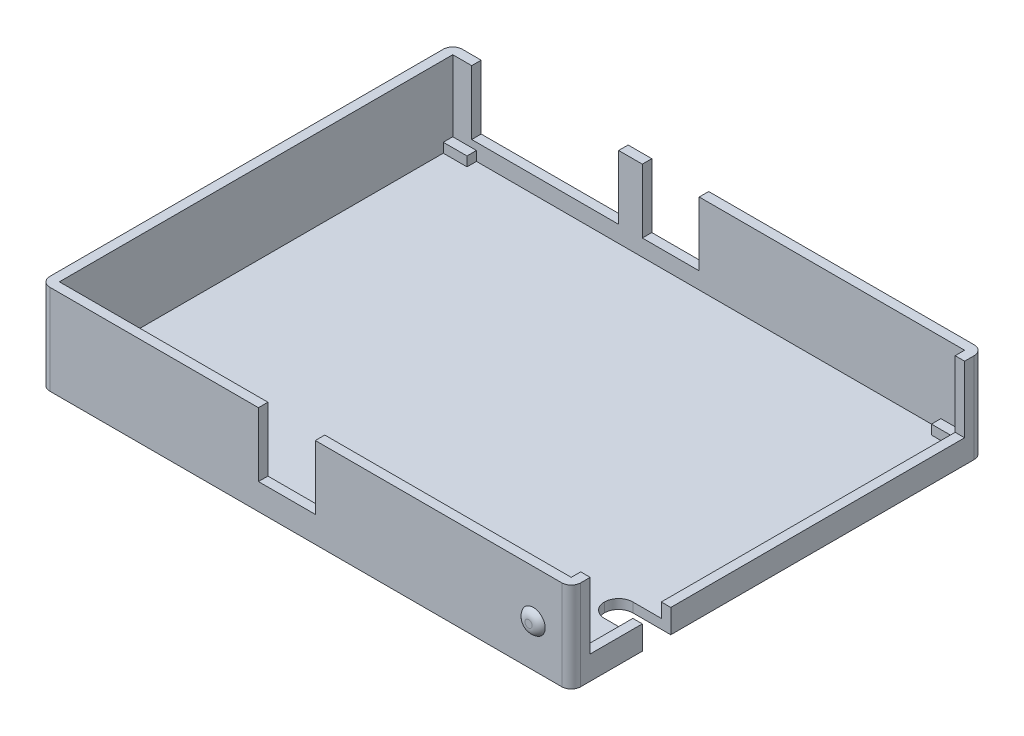
from build123d import *

# Parameters (mm, degrees)
SKETCH1_W           = 112
SKETCH1_H           = 87
BOSS_EXTRUDE1_DEPTH = 19
SKETCH3_W           = 108
SKETCH3_H           = 83
CUT_EXTRUDE1_DEPTH  = 17
SKETCH4_W           = 5
SKETCH4_H           = 2
BOSS_EXTRUDE3_DEPTH = 2
SKETCH5_W           = 5
SKETCH5_H           = 2
BOSS_EXTRUDE4_DEPTH = 2
SKETCH6_W           = 5
SKETCH6_H           = 2
BOSS_EXTRUDE5_DEPTH = 2
SKETCH7_W           = 5
SKETCH7_H           = 2
BOSS_EXTRUDE6_DEPTH = 2
SKETCH8_W           = 12
SKETCH8_H           = 13.5
CUT_EXTRUDE2_DEPTH  = 2
SKETCH9_W           = 31
SKETCH9_H           = 13.5
CUT_EXTRUDE3_DEPTH  = 2
SKETCH10_W          = 12
SKETCH10_H          = 13.5
CUT_EXTRUDE4_DEPTH  = 2
FILLET2_R           = 2
FILLET3_R           = 2
FILLET4_R           = 2
FILLET5_R           = 2
SKETCH11_W          = 0.314102564
SKETCH11_H          = 2.557692308
CUT_EXTRUDE5_DEPTH  = 0.5
SKETCH13_W          = 79
SKETCH13_H          = 14
CUT_EXTRUDE6_DEPTH  = 2
SKETCH14_W          = 6
SKETCH14_H          = 5
CUT_EXTRUDE8_DEPTH  = 11
FILLET6_R           = 3
SKETCH15_R          = 2.5
BOSS_EXTRUDE7_DEPTH = 1
BOSS_EXTRUDE8_START = 1
SKETCH16_R          = 2.5
BOSS_EXTRUDE8_DEPTH = 1
FILLET8_R           = 2
FILLET9_R           = 2


# Some blends are built 0.0001 mm under size
with BuildPart() as part:
    # Sketch1 → Boss-Extrude1 (new body)
    with BuildSketch(Plane(origin=(0, 0, 0), x_dir=(1, 0, 0), z_dir=(0, 1, 0))):
        with Locations((-56, 43.5)):
            Rectangle(SKETCH1_W, SKETCH1_H)
    extrude(amount=BOSS_EXTRUDE1_DEPTH)

    # Sketch3 → Cut-Extrude1 (cut)
    with BuildSketch(Plane(origin=(0, 19, 0), x_dir=(1, 0, 0), z_dir=(0, 1, 0))):
        with Locations((-56, 43.5)):
            Rectangle(SKETCH3_W, SKETCH3_H)
    extrude(amount=-CUT_EXTRUDE1_DEPTH, mode=Mode.SUBTRACT)

    # Sketch4 → Boss-Extrude3 (add)
    with BuildSketch(Plane(origin=(0, 2, 0), x_dir=(1, 0, 0), z_dir=(0, 1, 0))):
        with Locations((-107.5, 84)):
            Rectangle(SKETCH4_W, SKETCH4_H)
    extrude(amount=BOSS_EXTRUDE3_DEPTH)

    # Sketch5 → Boss-Extrude4 (add)
    with BuildSketch(Plane(origin=(0, 2, 0), x_dir=(1, 0, 0), z_dir=(0, 1, 0))):
        with Locations((-4.5, 84)):
            Rectangle(SKETCH5_W, SKETCH5_H)
    extrude(amount=BOSS_EXTRUDE4_DEPTH)

    # Sketch6 → Boss-Extrude5 (add)
    with BuildSketch(Plane(origin=(0, 2, 0), x_dir=(1, 0, 0), z_dir=(0, 1, 0))):
        with Locations((-107.5, 3)):
            Rectangle(SKETCH6_W, SKETCH6_H)
    extrude(amount=BOSS_EXTRUDE5_DEPTH)

    # Sketch7 → Boss-Extrude6 (add)
    with BuildSketch(Plane(origin=(0, 2, 0), x_dir=(1, 0, 0), z_dir=(0, 1, 0))):
        with Locations((-4.5, 3)):
            Rectangle(SKETCH7_W, SKETCH7_H)
    extrude(amount=BOSS_EXTRUDE6_DEPTH)

    # Sketch8 → Cut-Extrude2 (cut)
    with BuildSketch(Plane.XY):
        with Locations((-60, 12.25)):
            Rectangle(SKETCH8_W, SKETCH8_H)
    extrude(amount=-CUT_EXTRUDE2_DEPTH, mode=Mode.SUBTRACT)

    # Sketch9 → Cut-Extrude3 (cut)
    with BuildSketch(Plane(origin=(0, 0, -87), x_dir=(-1, 0, 0), z_dir=(0, 0, -1))):
        with Locations((90.5, 12.25)):
            Rectangle(SKETCH9_W, SKETCH9_H)
    extrude(amount=-CUT_EXTRUDE3_DEPTH, mode=Mode.SUBTRACT)

    # Sketch10 → Cut-Extrude4 (cut)
    with BuildSketch(Plane(origin=(0, 0, -87), x_dir=(-1, 0, 0), z_dir=(0, 0, -1))):
        with Locations((64, 12.25)):
            Rectangle(SKETCH10_W, SKETCH10_H)
    extrude(amount=-CUT_EXTRUDE4_DEPTH, mode=Mode.SUBTRACT)

    # Fillet2
    fillet2_edges = [part.edges().sort_by_distance(p)[0] for p in [
        (-112, 9.5, 0),
    ]]
    fillet(fillet2_edges, radius=FILLET2_R)

    # Fillet3
    fillet3_edges = [part.edges().sort_by_distance(p)[0] for p in [
        (0, 9.5, 0),
    ]]
    fillet(fillet3_edges, radius=FILLET3_R)

    # Fillet4
    fillet4_edges = [part.edges().sort_by_distance(p)[0] for p in [
        (0, 9.5, -87),
    ]]
    fillet(fillet4_edges, radius=FILLET4_R)

    # Fillet5
    fillet5_edges = [part.edges().sort_by_distance(p)[0] for p in [
        (-112, 9.5, -87),
    ]]
    fillet(fillet5_edges, radius=FILLET5_R)

    # Sketch11 → Cut-Extrude5 (cut)
    # profile 1 of 9: a face of its own
    with BuildSketch(Plane(origin=(0, 2, 0), x_dir=(1, 0, 0), z_dir=(0, 1, 0))):
        Polygon((-36.173713221, 7.144580339), (-35.711673958, 10.644580339), (-35.666802163, 10.644580339), (-34.221790144, 7.772785467), (-32.780283734, 10.644580339), (-32.734710817, 10.644580339), (-32.269867067, 7.144580339), (-32.585371875, 7.144580339), (-32.920508093, 9.663009826), (-34.183929567, 7.144580339), (-34.254742868, 7.144580339), (-35.523072195, 9.6686188), (-35.857507292, 7.144580339), align=None)
    # profile 2 of 9: a face of its own
    with BuildSketch(Plane(origin=(0, 2, 0), x_dir=(1, 0, 0), z_dir=(0, 1, 0))):
        with BuildLine():
            add(Edge.make_bspline(
                [(-31.530884695, 10.779195723), (-31.51139338, 10.778291571), (-31.47322564, 10.776521067), (-31.418032372, 10.76135959), (-31.36777536, 10.735659904), (-31.323197627, 10.701180224), (-31.28494574, 10.66063078), (-31.25816503, 10.613369812), (-31.240952634, 10.562311173), (-31.238874079, 10.526696084), (-31.237815785, 10.508562711)],
                knots=[0, 0, 0, 0, 1.055194115, 2.066272739, 3.074728998, 4.095836921, 5.109056067, 6.073838105, 7.019297344, 8, 8, 8, 8], degree=3))
            add(Edge.make_bspline(
                [(-31.237815785, 10.508562711), (-31.238897945, 10.490900057), (-31.241037247, 10.455983082), (-31.258151735, 10.40580961), (-31.285173973, 10.359205327), (-31.323173099, 10.318734617), (-31.36778186, 10.284273997), (-31.418030645, 10.258569258), (-31.473226094, 10.24340912), (-31.511393533, 10.241638432), (-31.530884695, 10.240734185)],
                knots=[0, 0, 0, 0, 0.96129708, 1.900370562, 2.859976407, 3.87933698, 4.906634145, 5.921202961, 6.938410037, 8, 8, 8, 8], degree=3))
            add(Edge.make_bspline(
                [(-31.530884695, 10.240734185), (-31.550152971, 10.241603905), (-31.587656151, 10.243296702), (-31.642022993, 10.25886672), (-31.691851482, 10.284282793), (-31.736516155, 10.318508978), (-31.773746348, 10.359453875), (-31.800844674, 10.405781169), (-31.817919636, 10.455990324), (-31.820064264, 10.49090249), (-31.821149118, 10.508562711)],
                knots=[0, 0, 0, 0, 1.054934014, 2.053291228, 3.073705704, 4.106921865, 5.123545215, 6.088680038, 7.033164197, 8, 8, 8, 8], degree=3))
            add(Edge.make_bspline(
                [(-31.821149118, 10.508562711), (-31.820088032, 10.52669356), (-31.818003991, 10.562303693), (-31.800831875, 10.613398726), (-31.773972067, 10.660380228), (-31.736491503, 10.701405727), (-31.691858043, 10.735651162), (-31.642021298, 10.761062143), (-31.587656599, 10.776633483), (-31.550153123, 10.778326097), (-31.530884695, 10.779195723)],
                knots=[0, 0, 0, 0, 0.98631895, 1.937192651, 2.907499808, 3.917963147, 4.944918757, 5.95915025, 6.951458133, 8, 8, 8, 8], degree=3))
        make_face()
    # profile 3 of 9: a face of its own
    with BuildSketch(Plane(origin=(0, 2, 0), x_dir=(1, 0, 0), z_dir=(0, 1, 0))):
        with Locations((-31.529482452, 8.423426493)):
            Rectangle(SKETCH11_W, SKETCH11_H)
    # profile 4 of 9: a face of its own
    with BuildSketch(Plane(origin=(0, 2, 0), x_dir=(1, 0, 0), z_dir=(0, 1, 0))):
        with BuildLine():
            Line((-28.096790144, 9.147685307), (-28.359710817, 8.984323929))
            add(Edge.make_bspline(
                [(-28.359710817, 8.984323929), (-28.388540683, 9.020152322), (-28.445287378, 9.090674433), (-28.543826614, 9.181684366), (-28.648838028, 9.259851408), (-28.762116076, 9.323555159), (-28.883501876, 9.372776609), (-29.012516727, 9.407606815), (-29.149142232, 9.429311057), (-29.242807431, 9.431777894), (-29.290800561, 9.433041877)],
                knots=[0, 0, 0, 0, 1.026593902, 2.0206758, 2.988051866, 3.946915611, 4.916868779, 5.907761954, 6.927957743, 8, 8, 8, 8], degree=3))
            add(Edge.make_bspline(
                [(-29.290800561, 9.433041877), (-29.329159518, 9.431985035), (-29.40470644, 9.429903613), (-29.515612594, 9.41689312), (-29.621254947, 9.393251111), (-29.722295656, 9.362100155), (-29.818016074, 9.320349865), (-29.908666993, 9.269540109), (-29.995052483, 9.210490068), (-30.074669224, 9.142079523), (-30.147498231, 9.067680855), (-30.210597145, 8.98792716), (-30.265534078, 8.905207269), (-30.308640035, 8.817455527), (-30.343915205, 8.726679473), (-30.367121925, 8.631165618), (-30.382586621, 8.53213761), (-30.384355949, 8.46461927), (-30.385251683, 8.430437711)],
                knots=[0, 0, 0, 0, 1.112346261, 2.190735716, 3.231507886, 4.247384806, 5.251966152, 6.253067467, 7.256802811, 8.280671706, 9.291813951, 10.270744147, 11.225547591, 12.165006084, 13.100104208, 14.043489273, 15.009504848, 16, 16, 16, 16], degree=3))
            add(Edge.make_bspline(
                [(-30.385251683, 8.430437711), (-30.38347243, 8.3856685), (-30.3799379, 8.296733304), (-30.35223644, 8.165455202), (-30.306892033, 8.038531512), (-30.244834182, 7.916863375), (-30.166357048, 7.804269219), (-30.074184484, 7.703285765), (-29.968265401, 7.615869737), (-29.84953307, 7.543397212), (-29.720775327, 7.485135844), (-29.583385222, 7.443628511), (-29.438485442, 7.418576139), (-29.339278695, 7.415420195), (-29.288697195, 7.413811108)],
                knots=[0, 0, 0, 0, 0.966302908, 1.919585723, 2.883856336, 3.870342332, 4.860282998, 5.839159637, 6.814385684, 7.815993281, 8.834850808, 9.858348828, 10.908058873, 12, 12, 12, 12], degree=3))
            add(Edge.make_bspline(
                [(-29.288697195, 7.413811108), (-29.242342011, 7.415110605), (-29.151241773, 7.417664462), (-29.018074488, 7.439193425), (-28.891294577, 7.474437059), (-28.770906546, 7.523584709), (-28.65713038, 7.587112225), (-28.550701205, 7.665471396), (-28.449501267, 7.756407996), (-28.39000429, 7.826725967), (-28.359710817, 7.862529057)],
                knots=[0, 0, 0, 0, 1.039848629, 2.043578496, 3.018386758, 3.987534228, 4.954977003, 5.934852016, 6.948509513, 8, 8, 8, 8], degree=3))
            Line((-28.359710817, 7.862529057), (-28.096790144, 7.690053095))
            add(Edge.make_bspline(
                [(-28.096790144, 7.690053095), (-28.112377846, 7.667162368), (-28.143501513, 7.621456892), (-28.195529139, 7.557012775), (-28.25164897, 7.496691093), (-28.311642067, 7.440572703), (-28.374725077, 7.387314683), (-28.443052987, 7.339463109), (-28.514422598, 7.294328286), (-28.589671756, 7.253715414), (-28.668022454, 7.217209092), (-28.749364443, 7.185817922), (-28.833344256, 7.158847816), (-28.920060632, 7.137410469), (-29.009684531, 7.120299631), (-29.101984165, 7.108945929), (-29.196927747, 7.100470648), (-29.261099898, 7.099964781), (-29.293605048, 7.099708544)],
                knots=[0, 0, 0, 0, 0.954134338, 1.905101784, 2.851144739, 3.791306361, 4.734911809, 5.6936923, 6.663572882, 7.643865596, 8.638447847, 9.640600242, 10.646758161, 11.676244097, 12.717260333, 13.78922464, 14.880174919, 16, 16, 16, 16], degree=3))
            add(Edge.make_bspline(
                [(-29.293605048, 7.099708544), (-29.343215932, 7.100599824), (-29.440453624, 7.102346739), (-29.582776131, 7.121555214), (-29.718789799, 7.15051283), (-29.848448157, 7.192076564), (-29.971771391, 7.245581339), (-30.088644509, 7.310938254), (-30.198680527, 7.388690044), (-30.30079131, 7.477452813), (-30.394572756, 7.573693454), (-30.475098946, 7.677543372), (-30.544944217, 7.78518442), (-30.60103176, 7.898993946), (-30.645678687, 8.017459319), (-30.676183519, 8.141529559), (-30.695913257, 8.270181813), (-30.698196636, 8.357914695), (-30.699354247, 8.402392839)],
                knots=[0, 0, 0, 0, 1.1129367, 2.181364009, 3.217532258, 4.231199276, 5.232079859, 6.230262199, 7.231623845, 8.250719726, 9.263571943, 10.242672461, 11.195837495, 12.138959767, 13.085126421, 14.0317438, 15.002148558, 16, 16, 16, 16], degree=3))
            add(Edge.make_bspline(
                [(-30.699354247, 8.402392839), (-30.698913231, 8.432571273), (-30.698035977, 8.492601161), (-30.687974049, 8.581696227), (-30.674975576, 8.669604773), (-30.652949839, 8.755212492), (-30.627509207, 8.839817782), (-30.595033675, 8.922400883), (-30.556938281, 9.003345556), (-30.513686333, 9.082443286), (-30.464997588, 9.158392825), (-30.411116355, 9.23014649), (-30.354072019, 9.298566256), (-30.291195907, 9.361290016), (-30.225156253, 9.420826207), (-30.154084677, 9.475584332), (-30.078388825, 9.525725323), (-29.999205503, 9.572176338), (-29.916580791, 9.613535773), (-29.831014121, 9.649169011), (-29.743021092, 9.679621587), (-29.652460948, 9.703730506), (-29.559934775, 9.72394793), (-29.464713437, 9.736665776), (-29.367161214, 9.745652049), (-29.301105192, 9.746642841), (-29.267663542, 9.747144441)],
                knots=[0, 0, 0, 0, 0.990994727, 1.971252077, 2.943264845, 3.907940874, 4.872158414, 5.844625996, 6.82015047, 7.809835459, 8.804511986, 9.781214284, 10.756496977, 11.728388426, 12.696359165, 13.676225489, 14.672885716, 15.677705647, 16.690706858, 17.706033469, 18.721040654, 19.747369689, 20.783475414, 21.830280724, 22.901553713, 24, 24, 24, 24], degree=3))
            add(Edge.make_bspline(
                [(-29.267663542, 9.747144441), (-29.225783433, 9.74622255), (-29.142232554, 9.744383376), (-29.018291847, 9.728904724), (-28.896176653, 9.705568308), (-28.77802955, 9.670995478), (-28.665283035, 9.629131822), (-28.559747585, 9.582119108), (-28.463907481, 9.527524504), (-28.375979892, 9.46780439), (-28.295800375, 9.400443484), (-28.222545882, 9.324636527), (-28.154714233, 9.240778048), (-28.116257522, 9.178972316), (-28.096790144, 9.147685307)],
                knots=[0, 0, 0, 0, 1.095225653, 2.184976855, 3.262915854, 4.344593502, 5.400796181, 6.407717688, 7.363229445, 8.282371371, 9.184954523, 10.097238608, 11.036792983, 12, 12, 12, 12], degree=3))
        make_face()
    # profile 5 of 9: a face of its own
    with BuildSketch(Plane(origin=(0, 2, 0), x_dir=(1, 0, 0), z_dir=(0, 1, 0))):
        with BuildLine():
            Line((-27.558328606, 9.702272647), (-27.244226042, 9.702272647))
            Line((-27.244226042, 9.702272647), (-27.244226042, 9.325770243))
            add(Edge.make_bspline(
                [(-27.244226042, 9.325770243), (-27.221037283, 9.360826071), (-27.176688962, 9.42787007), (-27.102976032, 9.516539371), (-27.027472701, 9.589954418), (-26.949817514, 9.648457937), (-26.869439414, 9.692271055), (-26.788102462, 9.724364091), (-26.704526992, 9.743341406), (-26.648365068, 9.745875065), (-26.620227644, 9.747144441)],
                knots=[0, 0, 0, 0, 1.2804753, 2.448899062, 3.506932113, 4.484331642, 5.4025378, 6.288909075, 7.142734305, 8, 8, 8, 8], degree=3))
            add(Edge.make_bspline(
                [(-26.620227644, 9.747144441), (-26.598401318, 9.745953915), (-26.553492232, 9.743504329), (-26.485509643, 9.726293504), (-26.415466191, 9.698815482), (-26.370323803, 9.672975259), (-26.346790144, 9.659504217)],
                knots=[0, 0, 0, 0, 0.901110191, 1.854092781, 2.881294221, 4, 4, 4, 4], degree=3))
            Line((-26.346790144, 9.659504217), (-26.519266106, 9.387468961))
            add(Edge.make_bspline(
                [(-26.519266106, 9.387468961), (-26.534375127, 9.394209227), (-26.563054941, 9.407003542), (-26.605009508, 9.422145552), (-26.643690844, 9.431061468), (-26.668334403, 9.432412186), (-26.679822997, 9.433041877)],
                knots=[0, 0, 0, 0, 1.180555205, 2.24091978, 3.179933427, 4, 4, 4, 4], degree=3))
            add(Edge.make_bspline(
                [(-26.679822997, 9.433041877), (-26.70502873, 9.43136184), (-26.75644112, 9.427935051), (-26.83192562, 9.400996243), (-26.905172825, 9.357471003), (-26.963344487, 9.309199891), (-27.00838674, 9.262652093), (-27.040526966, 9.222003691), (-27.070009713, 9.176425059), (-27.098179933, 9.126695376), (-27.123846227, 9.07196553), (-27.147800897, 9.012782316), (-27.169459759, 8.949077187), (-27.181810004, 8.904694667), (-27.188136298, 8.881960147)],
                knots=[0, 0, 0, 0, 1.125678352, 2.296057538, 3.5422874, 4.923748041, 5.663163013, 6.437101912, 7.23742474, 8.08941207, 8.991984279, 9.93940061, 10.944477711, 12, 12, 12, 12], degree=3))
            add(Edge.make_bspline(
                [(-27.188136298, 8.881960147), (-27.192868691, 8.861682973), (-27.203350583, 8.816770574), (-27.213542121, 8.74142205), (-27.223611639, 8.652398391), (-27.230708257, 8.549451798), (-27.237286299, 8.432839354), (-27.240996382, 8.302383408), (-27.244099522, 8.157950057), (-27.244182589, 8.056975704), (-27.244226042, 8.004155659)],
                knots=[0, 0, 0, 0, 0.566838948, 1.255505196, 2.06880316, 3.007127437, 4.065329342, 5.249902469, 6.561414163, 8, 8, 8, 8], degree=3))
            Line((-27.244226042, 8.004155659), (-27.244226042, 7.144580339))
            Line((-27.244226042, 7.144580339), (-27.558328606, 7.144580339))
            Line((-27.558328606, 7.144580339), (-27.558328606, 9.702272647))
        make_face()
    # profile 6 of 9: a face of its own
    with BuildSketch(Plane(origin=(0, 2, 0), x_dir=(1, 0, 0), z_dir=(0, 1, 0))):
        with BuildLine():
            add(Edge.make_bspline(
                [(-24.797310977, 9.747144441), (-24.749319705, 9.74612255), (-24.655220547, 9.744118871), (-24.517412661, 9.722703906), (-24.385867525, 9.689956541), (-24.260081333, 9.644684979), (-24.141665038, 9.584003029), (-24.028893793, 9.511593738), (-23.922076785, 9.425811144), (-23.858053755, 9.359453076), (-23.82555617, 9.325770243)],
                knots=[0, 0, 0, 0, 1.054011418, 2.066658804, 3.057071809, 4.030435133, 4.997543892, 5.974964718, 6.972108034, 8, 8, 8, 8], degree=3))
            add(Edge.make_bspline(
                [(-23.82555617, 9.325770243), (-23.797574216, 9.293556257), (-23.742151835, 9.229751715), (-23.671086117, 9.126296102), (-23.609864556, 9.019156001), (-23.560801595, 8.906908674), (-23.522116572, 8.790534003), (-23.494650876, 8.669631992), (-23.478313941, 8.544469645), (-23.476110974, 8.459465807), (-23.474995272, 8.416415275)],
                knots=[0, 0, 0, 0, 1.025258237, 2.030674902, 3.01204498, 3.988269485, 4.97094183, 5.956517959, 6.965070386, 8, 8, 8, 8], degree=3))
            add(Edge.make_bspline(
                [(-23.474995272, 8.416415275), (-23.47597661, 8.373115217), (-23.477915778, 8.287552284), (-23.496259394, 8.161532918), (-23.52479048, 8.039338095), (-23.565622318, 7.921479401), (-23.617980428, 7.807596574), (-23.681871115, 7.698187025), (-23.757742732, 7.593034892), (-23.843746729, 7.493033053), (-23.938798605, 7.400866838), (-24.041914754, 7.320538569), (-24.151068787, 7.251717045), (-24.267712141, 7.196280629), (-24.390779627, 7.152570929), (-24.520536696, 7.121870912), (-24.656781766, 7.103309228), (-24.749808987, 7.100925655), (-24.797310977, 7.099708544)],
                knots=[0, 0, 0, 0, 0.998656419, 1.973391657, 2.932242238, 3.890759089, 4.846373663, 5.82037756, 6.809684879, 7.83454468, 8.860553229, 9.859544525, 10.845671541, 11.83227036, 12.833544569, 13.85385346, 14.904124723, 16, 16, 16, 16], degree=3))
            add(Edge.make_bspline(
                [(-24.797310977, 7.099708544), (-24.845045697, 7.10092974), (-24.938536557, 7.103321515), (-25.075262539, 7.121798797), (-25.205252158, 7.15255678), (-25.328480756, 7.196424273), (-25.445625603, 7.251718816), (-25.5554121, 7.320330506), (-25.658612015, 7.400890661), (-25.753684, 7.493026598), (-25.839682605, 7.593036555), (-25.915555614, 7.698186593), (-25.97944594, 7.807596687), (-26.031804144, 7.921479371), (-26.072635956, 8.039338103), (-26.101167049, 8.161532916), (-26.119510664, 8.287552284), (-26.121449832, 8.373115217), (-26.12243117, 8.416415275)],
                knots=[0, 0, 0, 0, 1.099876186, 2.154163076, 3.173186993, 4.173200201, 5.163417411, 6.152872554, 7.150605724, 8.17532212, 9.198891216, 10.186952605, 11.159729845, 12.11414092, 13.071450619, 14.029093627, 15.002601286, 16, 16, 16, 16], degree=3))
            add(Edge.make_bspline(
                [(-26.12243117, 8.416415275), (-26.121307859, 8.459231821), (-26.119083898, 8.544001223), (-26.102763389, 8.668928284), (-26.075404832, 8.789625673), (-26.036673436, 8.905551149), (-25.987158245, 9.017306585), (-25.926796957, 9.124711416), (-25.855006325, 9.227699216), (-25.799804373, 9.291421296), (-25.771870272, 9.323666877)],
                knots=[0, 0, 0, 0, 1.031353054, 2.041901799, 3.029428768, 4.008703097, 4.981709435, 5.96992636, 6.972712378, 8, 8, 8, 8], degree=3))
            add(Edge.make_bspline(
                [(-25.771870272, 9.323666877), (-25.739421681, 9.357641817), (-25.675605817, 9.424459513), (-25.56825709, 9.509992037), (-25.455763269, 9.583908111), (-25.336038342, 9.643384326), (-25.210355484, 9.690222844), (-25.078136242, 9.722788359), (-24.939860726, 9.744041714), (-24.845301105, 9.746099892), (-24.797310977, 9.747144441)],
                knots=[0, 0, 0, 0, 1.027980169, 2.021703884, 2.998553061, 3.971491411, 4.943284454, 5.930300938, 6.949603206, 8, 8, 8, 8], degree=3))
        make_face()
        with BuildLine():
            add(Edge.make_bspline(
                [(-24.798713221, 9.433041877), (-24.832650832, 9.432077286), (-24.899649961, 9.430173003), (-24.998269546, 9.415689098), (-25.0932097, 9.392741594), (-25.184650544, 9.360137538), (-25.272283716, 9.318038639), (-25.356193119, 9.266330279), (-25.436625559, 9.205697322), (-25.512007622, 9.136234651), (-25.581189934, 9.060355656), (-25.641667911, 8.979507297), (-25.693093017, 8.895000951), (-25.735933176, 8.80674874), (-25.767840364, 8.713856326), (-25.791013387, 8.617375695), (-25.805483627, 8.517110278), (-25.807370006, 8.44894926), (-25.808328606, 8.414311909)],
                knots=[0, 0, 0, 0, 1.021534396, 2.016698045, 2.994645724, 3.958388632, 4.93408049, 5.916473867, 6.921342795, 7.962252576, 8.998418191, 10.008913653, 10.997312074, 11.973003931, 12.956656626, 13.948281152, 14.957379055, 16, 16, 16, 16], degree=3))
            add(Edge.make_bspline(
                [(-25.808328606, 8.414311909), (-25.806721782, 8.369559882), (-25.803532538, 8.280735477), (-25.777597301, 8.149924354), (-25.734211021, 8.024342502), (-25.675623742, 7.904726116), (-25.602217523, 7.794053838), (-25.515730456, 7.695382353), (-25.417090756, 7.610196542), (-25.307474256, 7.539515696), (-25.189119938, 7.483355941), (-25.063863617, 7.443556965), (-24.933222923, 7.417685273), (-24.843942191, 7.415113798), (-24.798713221, 7.413811108)],
                knots=[0, 0, 0, 0, 1.016792936, 2.018143844, 3.017858371, 4.030088057, 5.03801393, 6.028138512, 7.003788237, 7.991172063, 8.984598303, 9.972568034, 10.972917682, 12, 12, 12, 12], degree=3))
            add(Edge.make_bspline(
                [(-24.798713221, 7.413811108), (-24.753486852, 7.415121388), (-24.664211256, 7.417707845), (-24.533752079, 7.443426665), (-24.408838107, 7.483530326), (-24.29060672, 7.539452535), (-24.181040116, 7.61046495), (-24.081690995, 7.694901327), (-23.995942384, 7.794315179), (-23.922608779, 7.904872707), (-23.863062036, 8.02415706), (-23.819878835, 8.149947532), (-23.793881249, 8.280729574), (-23.79070042, 8.369557905), (-23.789097836, 8.414311909)],
                knots=[0, 0, 0, 0, 1.02726834, 2.027799167, 3.010890988, 4.004497153, 4.992059811, 5.971914811, 6.958719428, 7.966827853, 8.981595046, 9.981490638, 10.983022906, 12, 12, 12, 12], degree=3))
            add(Edge.make_bspline(
                [(-23.789097836, 8.414311909), (-23.790056106, 8.448949467), (-23.791941836, 8.517110893), (-23.8064168, 8.617373346), (-23.82957234, 8.713864943), (-23.861543957, 8.806716946), (-23.904197971, 8.895229451), (-23.956614764, 8.979259178), (-24.016845789, 9.060635724), (-24.08686291, 9.135989364), (-24.162166288, 9.205724401), (-24.242631326, 9.26635379), (-24.326416305, 9.317811386), (-24.413794887, 9.360497626), (-24.505247455, 9.392444967), (-24.600054584, 9.415821598), (-24.698253394, 9.430111795), (-24.765012437, 9.432058936), (-24.798713221, 9.433041877)],
                knots=[0, 0, 0, 0, 1.042956736, 2.052379634, 3.044323526, 4.02829302, 5.004299113, 5.996692471, 7.007513377, 8.048758398, 9.090003419, 10.095195979, 11.07790575, 12.047570684, 13.018257071, 13.989683339, 14.985167495, 16, 16, 16, 16], degree=3))
        make_face(mode=Mode.SUBTRACT)
    # profile 7 of 9: a face of its own
    with BuildSketch(Plane(origin=(0, 2, 0), x_dir=(1, 0, 0), z_dir=(0, 1, 0))):
        with BuildLine():
            Line((-22.757046554, 10.644580339), (-22.074153926, 10.644580339))
            add(Edge.make_bspline(
                [(-22.074153926, 10.644580339), (-22.040725448, 10.644404588), (-21.975932738, 10.64406394), (-21.881713296, 10.638780809), (-21.793464485, 10.631577139), (-21.711160713, 10.620147047), (-21.63484001, 10.60635527), (-21.564272373, 10.589653453), (-21.499682201, 10.56962684), (-21.422569464, 10.537780559), (-21.334648804, 10.49045739), (-21.239450411, 10.420528825), (-21.158046172, 10.334996362), (-21.087859854, 10.238513707), (-21.032058735, 10.132377935), (-20.991689437, 10.019118746), (-20.966131562, 9.900197004), (-20.963503128, 9.818553826), (-20.962174759, 9.777292679)],
                knots=[0, 0, 0, 0, 1.001505555, 1.941167018, 2.826882275, 3.653841531, 4.429895133, 5.150066043, 5.825578002, 6.45369114, 7.647487171, 8.808567382, 9.977351308, 11.170798116, 12.373658725, 13.556498008, 14.765093433, 16, 16, 16, 16], degree=3))
            add(Edge.make_bspline(
                [(-20.962174759, 9.777292679), (-20.963267978, 9.738640123), (-20.965416255, 9.662684206), (-20.985959015, 9.551590097), (-21.018119683, 9.445838878), (-21.062824932, 9.345816492), (-21.120926928, 9.253782879), (-21.189785247, 9.168995613), (-21.27286205, 9.095044556), (-21.33510529, 9.053701654), (-21.366722035, 9.032701332)],
                knots=[0, 0, 0, 0, 1.044552857, 2.05264487, 3.044412934, 4.028983338, 5.005914585, 5.980388656, 6.974128949, 8, 8, 8, 8], degree=3))
            add(Edge.make_bspline(
                [(-21.366722035, 9.032701332), (-21.326961608, 9.017436333), (-21.25089006, 8.988230609), (-21.146204048, 8.936595145), (-21.056009203, 8.880433035), (-20.979612057, 8.819101185), (-20.914274402, 8.752992374), (-20.85722146, 8.68113726), (-20.808540086, 8.602598502), (-20.766827163, 8.518194966), (-20.734278406, 8.428788498), (-20.709902502, 8.335217722), (-20.695935053, 8.237818167), (-20.693947412, 8.171532787), (-20.69294399, 8.138069922)],
                knots=[0, 0, 0, 0, 1.27268992, 2.434971085, 3.483601985, 4.442670788, 5.356604649, 6.2567628, 7.179492994, 8.113709626, 9.066344395, 10.018646069, 10.999752585, 12, 12, 12, 12], degree=3))
            add(Edge.make_bspline(
                [(-20.69294399, 8.138069922), (-20.693920836, 8.10390305), (-20.695842808, 8.036678772), (-20.71002278, 7.937923637), (-20.734031887, 7.843548691), (-20.767103033, 7.752943508), (-20.810265348, 7.666283374), (-20.862793312, 7.58347011), (-20.925424876, 7.505335779), (-20.995487745, 7.431012156), (-21.07474989, 7.364184369), (-21.160265645, 7.304668662), (-21.253111965, 7.2557226), (-21.351763959, 7.214606578), (-21.457328275, 7.18319938), (-21.569330883, 7.161226806), (-21.687675184, 7.146421769), (-21.768884936, 7.145204564), (-21.810532131, 7.144580339)],
                knots=[0, 0, 0, 0, 0.978564426, 1.925352924, 2.850884081, 3.763762016, 4.682927383, 5.618979971, 6.567305752, 7.547517671, 8.540179244, 9.531824382, 10.526200242, 11.540722885, 12.589160233, 13.674978461, 14.80764778, 16, 16, 16, 16], degree=3))
            Line((-21.810532131, 7.144580339), (-22.757046554, 7.144580339))
            Line((-22.757046554, 7.144580339), (-22.757046554, 10.644580339))
        make_face()
        with BuildLine():
            Line((-22.44294399, 10.28560598), (-22.44294399, 9.163811108))
            Line((-22.44294399, 9.163811108), (-22.23190633, 9.163811108))
            add(Edge.make_bspline(
                [(-22.23190633, 9.163811108), (-22.201057535, 9.164211031), (-22.141451375, 9.164983764), (-22.055131479, 9.167197281), (-21.975006461, 9.173395324), (-21.901214628, 9.179591586), (-21.833872184, 9.189666174), (-21.773128322, 9.201658297), (-21.718029725, 9.214341202), (-21.65449018, 9.235910689), (-21.582417231, 9.267788364), (-21.505584127, 9.3172602), (-21.437849657, 9.376184553), (-21.38065247, 9.444175515), (-21.333840999, 9.519041701), (-21.301327284, 9.599588581), (-21.27928, 9.683808713), (-21.277288468, 9.741626966), (-21.276277324, 9.770982582)],
                knots=[0, 0, 0, 0, 1.156816544, 2.235205308, 3.236616184, 4.169592532, 5.011045266, 5.787822928, 6.49130361, 7.128639758, 8.301311294, 9.436451833, 10.541879658, 11.654887649, 12.756523258, 13.837046038, 14.901820046, 16, 16, 16, 16], degree=3))
            add(Edge.make_bspline(
                [(-21.276277324, 9.770982582), (-21.276803504, 9.790408354), (-21.277835664, 9.828514126), (-21.286288966, 9.88406348), (-21.300656541, 9.936307233), (-21.319110834, 9.985961343), (-21.344899523, 10.031473193), (-21.375262986, 10.074416389), (-21.411948676, 10.113328507), (-21.453705989, 10.149698006), (-21.501714612, 10.181942534), (-21.555945904, 10.210183297), (-21.617133581, 10.232924073), (-21.684246436, 10.252840226), (-21.758317523, 10.26682852), (-21.838492077, 10.278481907), (-21.925426796, 10.284414649), (-21.985571898, 10.285200012), (-22.016661939, 10.28560598)],
                knots=[0, 0, 0, 0, 0.91205012, 1.789085906, 2.630437955, 3.453916878, 4.269457761, 5.079663411, 5.91843418, 6.774407191, 7.675494373, 8.627863946, 9.638891023, 10.736472738, 11.911756761, 13.175263542, 14.539845004, 16, 16, 16, 16], degree=3))
            Line((-22.016661939, 10.28560598), (-22.44294399, 10.28560598))
        make_face(mode=Mode.SUBTRACT)
        with BuildLine():
            Line((-22.44294399, 8.804836749), (-22.44294399, 7.503554698))
            Line((-22.44294399, 7.503554698), (-21.995628285, 7.503554698))
            add(Edge.make_bspline(
                [(-21.995628285, 7.503554698), (-21.963609359, 7.503938445), (-21.901897101, 7.504678068), (-21.812795871, 7.507092622), (-21.730212767, 7.512584898), (-21.654524631, 7.521230748), (-21.584914178, 7.530609197), (-21.522216475, 7.543220478), (-21.465923282, 7.557669438), (-21.400648974, 7.58000361), (-21.327145466, 7.614700081), (-21.247934609, 7.667014308), (-21.177508391, 7.729337616), (-21.117703132, 7.80146853), (-21.068690144, 7.879899857), (-21.033034688, 7.963045207), (-21.011043832, 8.049530734), (-21.008381662, 8.108497447), (-21.007046554, 8.138069922)],
                knots=[0, 0, 0, 0, 1.160039823, 2.235823828, 3.228722157, 4.157150951, 4.99529583, 5.772374946, 6.472645482, 7.099169577, 8.269452708, 9.405989375, 10.527446681, 11.663510218, 12.788923519, 13.866172445, 14.929861265, 16, 16, 16, 16], degree=3))
            add(Edge.make_bspline(
                [(-21.007046554, 8.138069922), (-21.007322659, 8.156563263), (-21.007870414, 8.193251644), (-21.016131029, 8.247167464), (-21.028144898, 8.299393337), (-21.043676332, 8.350071077), (-21.066295799, 8.398284454), (-21.092702344, 8.444987013), (-21.123663746, 8.490240493), (-21.171907912, 8.547452746), (-21.242079897, 8.613369759), (-21.341786672, 8.677907261), (-21.45515897, 8.729955068), (-21.537386463, 8.752054545), (-21.579863061, 8.763470563)],
                knots=[0, 0, 0, 0, 0.723448775, 1.435228256, 2.130040452, 2.821711965, 3.505591119, 4.210454504, 4.921174351, 5.648778258, 7.137944449, 8.670945889, 10.280296675, 12, 12, 12, 12], degree=3))
            add(Edge.make_bspline(
                [(-21.579863061, 8.763470563), (-21.596892157, 8.766925647), (-21.633814749, 8.774416982), (-21.694022329, 8.782324685), (-21.762758198, 8.789369745), (-21.840181076, 8.794580903), (-21.926388917, 8.799967446), (-22.021565835, 8.802062267), (-22.12532315, 8.804561528), (-22.197315522, 8.804742662), (-22.234710817, 8.804836749)],
                knots=[0, 0, 0, 0, 0.634451884, 1.375622551, 2.216452059, 3.157844607, 4.20941857, 5.370758133, 6.634282058, 8, 8, 8, 8], degree=3))
            Line((-22.234710817, 8.804836749), (-22.44294399, 8.804836749))
        make_face(mode=Mode.SUBTRACT)
    # profile 8 of 9: a face of its own
    with BuildSketch(Plane(origin=(0, 2, 0), x_dir=(1, 0, 0), z_dir=(0, 1, 0))):
        with BuildLine():
            add(Edge.make_bspline(
                [(-18.829362259, 9.747144441), (-18.781370987, 9.74612255), (-18.687271829, 9.744118871), (-18.549463943, 9.722703906), (-18.417918807, 9.689956541), (-18.292132615, 9.644684979), (-18.17371632, 9.584003029), (-18.060945076, 9.511593738), (-17.954128067, 9.425811144), (-17.890105037, 9.359453076), (-17.857607452, 9.325770243)],
                knots=[0, 0, 0, 0, 1.054011418, 2.066658804, 3.057071809, 4.030435133, 4.997543892, 5.974964718, 6.972108034, 8, 8, 8, 8], degree=3))
            add(Edge.make_bspline(
                [(-17.857607452, 9.325770243), (-17.829625498, 9.293556257), (-17.774203117, 9.229751715), (-17.703137399, 9.126296102), (-17.641915839, 9.019156001), (-17.592852878, 8.906908674), (-17.554167854, 8.790534003), (-17.526702158, 8.669631992), (-17.510365223, 8.544469645), (-17.508162256, 8.459465807), (-17.507046554, 8.416415275)],
                knots=[0, 0, 0, 0, 1.025258237, 2.030674902, 3.01204498, 3.988269485, 4.97094183, 5.956517959, 6.965070386, 8, 8, 8, 8], degree=3))
            add(Edge.make_bspline(
                [(-17.507046554, 8.416415275), (-17.508027892, 8.373115217), (-17.50996706, 8.287552284), (-17.528310676, 8.161532918), (-17.556841762, 8.039338095), (-17.5976736, 7.921479401), (-17.65003171, 7.807596574), (-17.713922397, 7.698187025), (-17.789794014, 7.593034892), (-17.875798011, 7.493033053), (-17.970849887, 7.400866838), (-18.073966036, 7.320538569), (-18.183120069, 7.251717045), (-18.299763423, 7.196280629), (-18.422830909, 7.152570929), (-18.552587978, 7.121870912), (-18.688833048, 7.103309228), (-18.781860269, 7.100925655), (-18.829362259, 7.099708544)],
                knots=[0, 0, 0, 0, 0.998656419, 1.973391657, 2.932242238, 3.890759089, 4.846373663, 5.82037756, 6.809684879, 7.83454468, 8.860553229, 9.859544525, 10.845671541, 11.83227036, 12.833544569, 13.85385346, 14.904124723, 16, 16, 16, 16], degree=3))
            add(Edge.make_bspline(
                [(-18.829362259, 7.099708544), (-18.877096979, 7.10092974), (-18.970587839, 7.103321515), (-19.107313821, 7.121798797), (-19.23730344, 7.15255678), (-19.360532038, 7.196424273), (-19.477676885, 7.251718816), (-19.587463382, 7.320330506), (-19.690663298, 7.400890661), (-19.785735282, 7.493026598), (-19.871733887, 7.593036555), (-19.947606896, 7.698186593), (-20.011497222, 7.807596687), (-20.063855426, 7.921479371), (-20.104687239, 8.039338103), (-20.133218331, 8.161532916), (-20.151561946, 8.287552284), (-20.153501114, 8.373115217), (-20.154482452, 8.416415275)],
                knots=[0, 0, 0, 0, 1.099876186, 2.154163076, 3.173186993, 4.173200201, 5.163417411, 6.152872554, 7.150605724, 8.17532212, 9.198891216, 10.186952605, 11.159729845, 12.11414092, 13.071450619, 14.029093627, 15.002601286, 16, 16, 16, 16], degree=3))
            add(Edge.make_bspline(
                [(-20.154482452, 8.416415275), (-20.153359141, 8.459231821), (-20.15113518, 8.544001223), (-20.134814671, 8.668928284), (-20.107456114, 8.789625673), (-20.068724718, 8.905551149), (-20.019209527, 9.017306585), (-19.958848239, 9.124711416), (-19.887057607, 9.227699216), (-19.831855655, 9.291421296), (-19.803921554, 9.323666877)],
                knots=[0, 0, 0, 0, 1.031353054, 2.041901799, 3.029428768, 4.008703097, 4.981709435, 5.96992636, 6.972712378, 8, 8, 8, 8], degree=3))
            add(Edge.make_bspline(
                [(-19.803921554, 9.323666877), (-19.771472963, 9.357641817), (-19.707657099, 9.424459513), (-19.600308372, 9.509992037), (-19.487814551, 9.583908111), (-19.368089624, 9.643384326), (-19.242406767, 9.690222844), (-19.110187524, 9.722788359), (-18.971912009, 9.744041714), (-18.877352387, 9.746099892), (-18.829362259, 9.747144441)],
                knots=[0, 0, 0, 0, 1.027980169, 2.021703884, 2.998553061, 3.971491411, 4.943284454, 5.930300938, 6.949603206, 8, 8, 8, 8], degree=3))
        make_face()
        with BuildLine():
            add(Edge.make_bspline(
                [(-18.830764503, 9.433041877), (-18.864702114, 9.432077286), (-18.931701243, 9.430173003), (-19.030320828, 9.415689098), (-19.125260982, 9.392741594), (-19.216701826, 9.360137538), (-19.304334998, 9.318038639), (-19.388244401, 9.266330279), (-19.468676841, 9.205697322), (-19.544058904, 9.136234651), (-19.613241216, 9.060355656), (-19.673719193, 8.979507297), (-19.725144299, 8.895000951), (-19.767984458, 8.80674874), (-19.799891646, 8.713856326), (-19.823064669, 8.617375695), (-19.837534909, 8.517110278), (-19.839421288, 8.44894926), (-19.840379888, 8.414311909)],
                knots=[0, 0, 0, 0, 1.021534396, 2.016698045, 2.994645724, 3.958388632, 4.93408049, 5.916473867, 6.921342795, 7.962252576, 8.998418191, 10.008913653, 10.997312074, 11.973003931, 12.956656626, 13.948281152, 14.957379055, 16, 16, 16, 16], degree=3))
            add(Edge.make_bspline(
                [(-19.840379888, 8.414311909), (-19.838773064, 8.369559882), (-19.83558382, 8.280735477), (-19.809648583, 8.149924354), (-19.766262303, 8.024342502), (-19.707675024, 7.904726116), (-19.634268805, 7.794053838), (-19.547781738, 7.695382353), (-19.449142038, 7.610196542), (-19.339525538, 7.539515696), (-19.22117122, 7.483355941), (-19.095914899, 7.443556965), (-18.965274205, 7.417685273), (-18.875993473, 7.415113798), (-18.830764503, 7.413811108)],
                knots=[0, 0, 0, 0, 1.016792936, 2.018143844, 3.017858371, 4.030088057, 5.03801393, 6.028138512, 7.003788237, 7.991172063, 8.984598303, 9.972568034, 10.972917682, 12, 12, 12, 12], degree=3))
            add(Edge.make_bspline(
                [(-18.830764503, 7.413811108), (-18.785538134, 7.415121388), (-18.696262538, 7.417707845), (-18.565803361, 7.443426665), (-18.440889389, 7.483530326), (-18.322658002, 7.539452535), (-18.213091399, 7.61046495), (-18.113742277, 7.694901327), (-18.027993666, 7.794315179), (-17.954660061, 7.904872707), (-17.895113318, 8.02415706), (-17.851930117, 8.149947532), (-17.825932531, 8.280729574), (-17.822751702, 8.369557905), (-17.821149118, 8.414311909)],
                knots=[0, 0, 0, 0, 1.02726834, 2.027799167, 3.010890988, 4.004497153, 4.992059811, 5.971914811, 6.958719428, 7.966827853, 8.981595046, 9.981490638, 10.983022906, 12, 12, 12, 12], degree=3))
            add(Edge.make_bspline(
                [(-17.821149118, 8.414311909), (-17.822107388, 8.448949467), (-17.823993118, 8.517110893), (-17.838468082, 8.617373346), (-17.861623622, 8.713864943), (-17.893595239, 8.806716946), (-17.936249253, 8.895229451), (-17.988666046, 8.979259178), (-18.048897071, 9.060635724), (-18.118914192, 9.135989364), (-18.19421757, 9.205724401), (-18.274682608, 9.26635379), (-18.358467587, 9.317811386), (-18.445846169, 9.360497626), (-18.537298737, 9.392444967), (-18.632105866, 9.415821598), (-18.730304676, 9.430111795), (-18.797063719, 9.432058936), (-18.830764503, 9.433041877)],
                knots=[0, 0, 0, 0, 1.042956736, 2.052379634, 3.044323526, 4.02829302, 5.004299113, 5.996692471, 7.007513377, 8.048758398, 9.090003419, 10.095195979, 11.07790575, 12.047570684, 13.018257071, 13.989683339, 14.985167495, 16, 16, 16, 16], degree=3))
        make_face(mode=Mode.SUBTRACT)
    # profile 9 of 9: a face of its own
    with BuildSketch(Plane(origin=(0, 2, 0), x_dir=(1, 0, 0), z_dir=(0, 1, 0))):
        Polygon((-17.1032004, 9.702272647), (-16.729502484, 9.702272647), (-16.071149118, 8.779596364), (-15.412795753, 9.702272647), (-15.039097836, 9.702272647), (-15.883949599, 8.518077935), (-14.904482452, 7.144580339), (-15.278180368, 7.144580339), (-16.071149118, 8.255858384), (-16.864117868, 7.144580339), (-17.237815785, 7.144580339), (-16.257647516, 8.518077935), align=None)
    extrude(amount=-CUT_EXTRUDE5_DEPTH, mode=Mode.SUBTRACT)

    # Sketch13 → Cut-Extrude6 (cut)
    with BuildSketch(Plane(origin=(0, 0, 0), x_dir=(0, 0, -1), z_dir=(1, 0, 0))):
        with Locations((43.5, 12)):
            Rectangle(SKETCH13_W, SKETCH13_H)
    extrude(amount=-CUT_EXTRUDE6_DEPTH, mode=Mode.SUBTRACT)

    # Sketch14 → Cut-Extrude8 (cut)
    with BuildSketch(Plane(origin=(0, 0, 0), x_dir=(0, 0, -1), z_dir=(1, 0, 0))):
        with Locations((18, 2.5)):
            Rectangle(SKETCH14_W, SKETCH14_H)
    extrude(amount=-CUT_EXTRUDE8_DEPTH, mode=Mode.SUBTRACT)

    # Fillet6
    fillet6_edges = [part.edges().sort_by_distance(p)[0] for p in [
        (-11, 1, -21),
        (-11, 1, -15),
    ]]
    fillet(fillet6_edges, radius=FILLET6_R - 0.0001)  # a hair under: the kernel refuses the full size

    # Sketch15 → Boss-Extrude7 (add)
    with BuildSketch(Plane.XY):
        with Locations(Location((-8, 9, 0), (0, 0, 180))):
            Circle(SKETCH15_R)
    extrude(amount=BOSS_EXTRUDE7_DEPTH)

    # Sketch16 → Boss-Extrude8 (add)
    with BuildSketch(Plane(origin=(0, 0, -87), x_dir=(-1, 0, 0), z_dir=(0, 0, -1)).offset(BOSS_EXTRUDE8_START)):
        with Locations((8, 9)):
            Circle(SKETCH16_R)
    extrude(amount=-BOSS_EXTRUDE8_DEPTH)

    # Fillet8
    # the kernel refuses this fillet: 2 mm, written as the material it takes off along each edge
    with BuildSketch(Plane(origin=(-8, 9, 1), x_dir=(-1, 0, 0), z_dir=(0, 1, 0))) as fillet8_piece_1:
        with BuildLine():
            CenterArc((0.767949192, -2), FILLET8_R, 30, 60)
            Line((0.767949192, 0), (0.767949192, 0.04))
            Line((0.767949192, 0.04), (2.5, 0.04))
            Line((2.5, 0.04), (2.54, 0))
            ThreePointArc((2.54, 0), (2.54, -0.5), (2.534641016, -0.98))
            Line((2.534641016, -0.98), (2.5, -1))
        make_face()
    revolve(axis=Axis((-8, 9, 1), (0, 0, 1)), mode=Mode.SUBTRACT)

    # Fillet9
    # the kernel refuses this fillet: 2 mm, written as the material it takes off along each edge
    with BuildSketch(Plane(origin=(-8, 9, -88), x_dir=(-1, 0, 0), z_dir=(0, -1, 0))) as fillet9_piece_1:
        with BuildLine():
            CenterArc((0.767949192, -2), FILLET9_R, 30, 60)
            Line((0.767949192, 0), (0.767949192, 0.04))
            Line((0.767949192, 0.04), (2.5, 0.04))
            Line((2.5, 0.04), (2.54, 0))
            ThreePointArc((2.54, 0), (2.54, -0.5), (2.534641016, -0.98))
            Line((2.534641016, -0.98), (2.5, -1))
        make_face()
    revolve(axis=Axis((-8, 9, -88), (0, 0, -1)), mode=Mode.SUBTRACT)


solid = part.part
